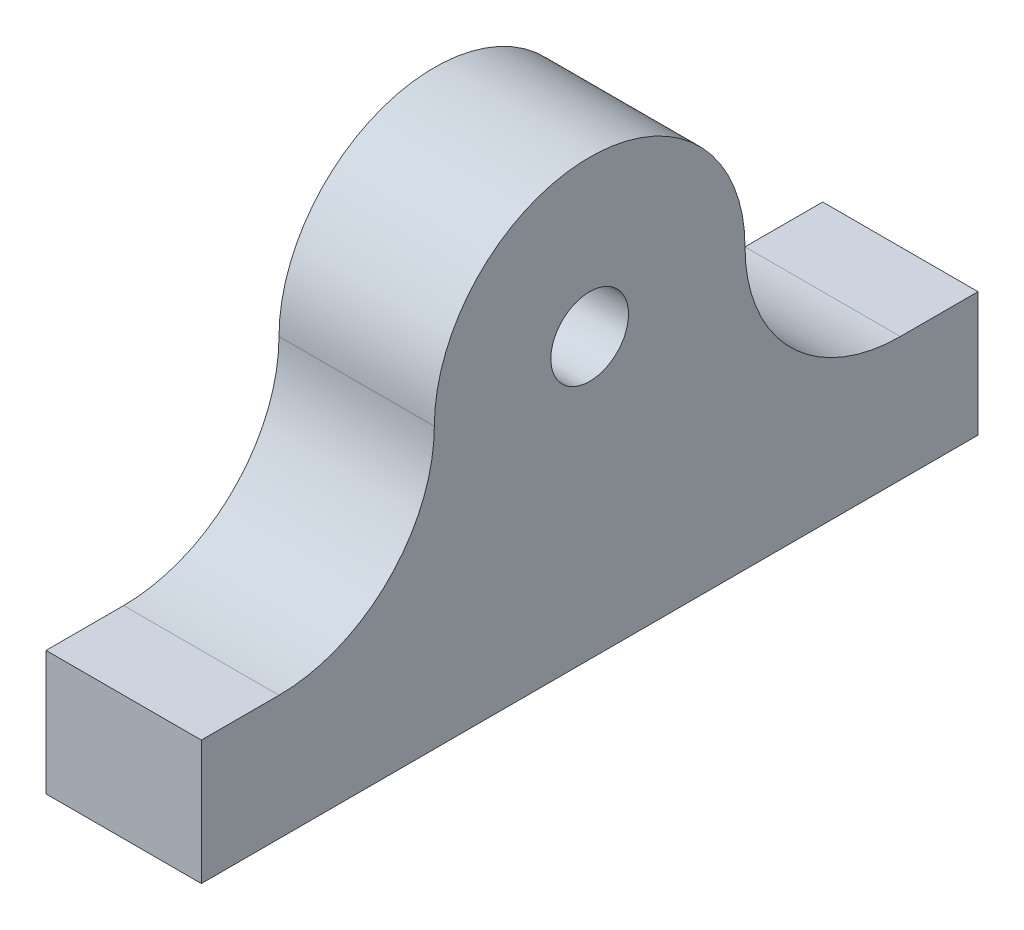
from build123d import *

# Parameters (mm, degrees)
SKETCH_1_R      = 2.5
EXTRUDE_1_DEPTH = 10
FILLET_1_R      = 10


with BuildPart() as part:
    # 草圖1 → 填料-伸長1 (new body)
    with BuildSketch(Plane(origin=(0, 0, 0), x_dir=(0, 0, -1), z_dir=(1, 0, 0))):
        with BuildLine():
            Line((-25, 0), (25, 0))
            Line((25, 0), (25, 8))
            Line((25, 8), (10, 8))
            Line((10, 8), (10, 18))
            ThreePointArc((10, 18), (0, 28), (-10, 18))
            Line((-10, 18), (-10, 8))
            Line((-10, 8), (-25, 8))
            Line((-25, 8), (-25, 0))
        make_face()
        with Locations((0, 18)):
            Circle(SKETCH_1_R, mode=Mode.SUBTRACT)
    extrude(amount=EXTRUDE_1_DEPTH)

    # 圓角1
    fillet_1_edges = [part.edges().sort_by_distance(p)[0] for p in [
        (5, 8, -10),
        (5, 8, 10),
    ]]
    fillet(fillet_1_edges, radius=FILLET_1_R - 0.0001)  # a hair under: the kernel refuses the full size


solid = part.part
